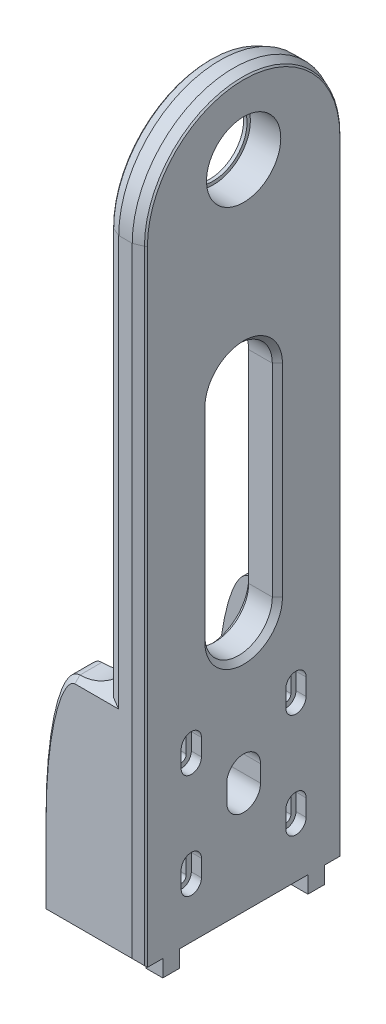
from build123d import *

# Parameters (mm, degrees)
SKETCH1_W           = 30
SKETCH1_H           = 5
BOSS_EXTRUDE1_DEPTH = 30
SKETCH2_W           = 10
SKETCH2_H           = 60
BOSS_EXTRUDE2_DEPTH = 210
SKETCH4_R           = 10
CUT_EXTRUDE1_DEPTH  = 10
CUT_EXTRUDE2_DEPTH  = 3
SKETCH6_R           = 11
CUT_EXTRUDE3_DEPTH  = 9
SKETCH7_R           = 1.5
SKETCH7_R_2         = 1.325
CUT_EXTRUDE4_DEPTH  = 15
SKETCH8_W           = 4.95
SKETCH8_H           = 4.9
BOSS_EXTRUDE3_DEPTH = 5
SKETCH10_W          = 8
SKETCH10_H          = 60
BOSS_EXTRUDE4_DEPTH = 20
FILLET1_RADIUS      = 30
FILLET1_LENGTH      = 10
FILLET3_SIZE        = 10
FILLET3_SIZE_2      = 40
FILLET4_SIZE        = 10
FILLET4_SIZE_2      = 40
CHAMFER1_SIZE       = 1.5
CHAMFER2_SIZE       = 1.5
CHAMFER3_SIZE       = 1.5
FILLET7_START       = 22
FILLET7_DEPTH       = 3.23595
FILLET7_START_2     = 25.23595
FILLET7_2_DEPTH     = 3.2640501
FILLET7_START_3     = -6
FILLET7_3_DEPTH     = 11
FILLET8_START       = -25.26405
FILLET8_DEPTH       = 3.26405
FILLET8_START_2     = -28.5000001
FILLET8_2_DEPTH     = 3.2359501
FILLET8_START_3     = -6
FILLET8_3_DEPTH     = 11


with BuildPart() as part:
    # Sketch1 → Boss-Extrude1 (new, symmetric)
    with BuildSketch(Plane.XY):
        with Locations((0, -2.5)):
            Rectangle(SKETCH1_W, SKETCH1_H)
    extrude(amount=BOSS_EXTRUDE1_DEPTH, both=True)

    # Sketch2 → Boss-Extrude2 (add)
    with BuildSketch(Plane(origin=(0, 0, 0), x_dir=(1, 0, 0), z_dir=(0, 1, 0))):
        with Locations((10, 0)):
            Rectangle(SKETCH2_W, SKETCH2_H)
    extrude(amount=BOSS_EXTRUDE2_DEPTH)

    # Sketch4 → Cut-Extrude1 (cut)
    with BuildSketch(Plane.ZY.offset(-5)):
        with Locations((0, 188)):
            Circle(SKETCH4_R)
        with BuildLine():
            Line((-17, 41), (-17, 46))
            ThreePointArc((-17, 46), (-15.5, 47.5), (-14, 46))
            Line((-14, 46), (-14, 41))
            ThreePointArc((-14, 41), (-15.5, 39.5), (-17, 41))
        make_face()
        with BuildLine():
            Line((14, 41), (14, 46))
            ThreePointArc((14, 46), (15.5, 47.5), (17, 46))
            Line((17, 46), (17, 41))
            ThreePointArc((17, 41), (15.5, 39.5), (14, 41))
        make_face()
        with BuildLine():
            Line((14, 10), (14, 15))
            ThreePointArc((14, 15), (15.5, 16.5), (17, 15))
            Line((17, 15), (17, 10))
            ThreePointArc((17, 10), (15.5, 8.5), (14, 10))
        make_face()
        with BuildLine():
            Line((-17, 10), (-17, 15))
            ThreePointArc((-17, 15), (-15.5, 16.5), (-14, 15))
            Line((-14, 15), (-14, 10))
            ThreePointArc((-14, 10), (-15.5, 8.5), (-17, 10))
        make_face()
        with BuildLine():
            Line((-5, 25.5), (-5, 30.5))
            ThreePointArc((-5, 30.5), (0, 35.5), (5, 30.5))
            Line((5, 30.5), (5, 25.5))
            ThreePointArc((5, 25.5), (0, 20.5), (-5, 25.5))
        make_face()
        with BuildLine():
            Line((-10, 70), (-10, 130))
            ThreePointArc((-10, 130), (0, 140), (10, 130))
            Line((10, 130), (10, 70))
            ThreePointArc((10, 70), (0, 60), (-10, 70))
        make_face()
    extrude(amount=-CUT_EXTRUDE1_DEPTH, mode=Mode.SUBTRACT)

    # Sketch5 → Cut-Extrude2 (cut)
    with BuildSketch(Plane(origin=(15, 0, 0), x_dir=(0, 0, -1), z_dir=(1, 0, 0))):
        with BuildLine():
            Line((-18.5, 41), (-18.5, 46))
            ThreePointArc((-18.5, 46), (-15.5, 49), (-12.5, 46))
            Line((-12.5, 46), (-12.5, 41))
            ThreePointArc((-12.5, 41), (-15.5, 38), (-18.5, 41))
        make_face()
        with BuildLine():
            Line((12.5, 41), (12.5, 46))
            ThreePointArc((12.5, 46), (15.5, 49), (18.5, 46))
            Line((18.5, 46), (18.5, 41))
            ThreePointArc((18.5, 41), (15.5, 38), (12.5, 41))
        make_face()
        with BuildLine():
            Line((12.5, 10), (12.5, 15))
            ThreePointArc((12.5, 15), (15.5, 18), (18.5, 15))
            Line((18.5, 15), (18.5, 10))
            ThreePointArc((18.5, 10), (15.5, 7), (12.5, 10))
        make_face()
        with BuildLine():
            Line((-18.5, 10), (-18.5, 15))
            ThreePointArc((-18.5, 15), (-15.5, 18), (-12.5, 15))
            Line((-12.5, 15), (-12.5, 10))
            ThreePointArc((-12.5, 10), (-15.5, 7), (-18.5, 10))
        make_face()
    extrude(amount=-CUT_EXTRUDE2_DEPTH, mode=Mode.SUBTRACT)

    # Sketch6 → Cut-Extrude3 (cut)
    with BuildSketch(Plane(origin=(15, 0, 0), x_dir=(0, 0, -1), z_dir=(1, 0, 0))):
        with Locations((0, 188)):
            Circle(SKETCH6_R)
    extrude(amount=-CUT_EXTRUDE3_DEPTH, mode=Mode.SUBTRACT)

    # Sketch7 → Cut-Extrude4 (cut)
    with BuildSketch(Plane.XZ.offset(5)):
        with Locations(Location((0, -15, 0), (0, 0, 270))):
            Circle(SKETCH7_R)
        with Locations(Location((0, 15, 0), (0, 0, 270))):
            Circle(SKETCH7_R)
        with Locations(Location((10, 0, 0), (0, 0, 90))):
            Circle(SKETCH7_R_2)
    extrude(amount=-CUT_EXTRUDE4_DEPTH, mode=Mode.SUBTRACT)

    # Sketch8 → Boss-Extrude3 (add)
    with BuildSketch(Plane.XZ.offset(5)):
        with Locations((12.525, 21.5)):
            Rectangle(SKETCH8_W, SKETCH8_H)
        with Locations((12.525, -21.5)):
            Rectangle(SKETCH8_W, SKETCH8_H)
    extrude(amount=BOSS_EXTRUDE3_DEPTH)

    # Sketch10 → Boss-Extrude4 (add)
    with BuildSketch(Plane.ZY.offset(-5)):
        with Locations((26, 30)):
            Rectangle(SKETCH10_W, SKETCH10_H)
        with Locations((-26, 30)):
            Rectangle(SKETCH10_W, SKETCH10_H)
    extrude(amount=BOSS_EXTRUDE4_DEPTH)

    # Fillet1: full round fillet: the end face becomes a half cylinder, R = half its width
    fillet1_face = Plane((10, 210, 0), x_dir=(-1, 0, 0), z_dir=(0, 1, 0))  # on the end face: x along it, z out of the body
    fillet1_slab = fillet1_face.offset(-FILLET1_RADIUS / 2) * Box(FILLET1_LENGTH, 2 * FILLET1_RADIUS, FILLET1_RADIUS, mode=Mode.PRIVATE)  # the body's end, R deep
    fillet1_round = Plane((10, 180, 0), x_dir=(0, 1, 0), z_dir=(-1, 0, 0)) * Cylinder(FILLET1_RADIUS, FILLET1_LENGTH, mode=Mode.PRIVATE)  # its axis R under the face
    add(fillet1_slab - fillet1_round, mode=Mode.SUBTRACT)

    # Fillet3
    # a fillet whose section is not a circle: 40, 10 mm, written as the material it takes off along each edge
    with BuildSketch(Plane(origin=(-15, 60, 78), x_dir=(1, 0, 0), z_dir=(0, 0, -1))) as fillet3_piece_1_section:
        with BuildLine():
            Bezier((FILLET3_SIZE, 0), (0, 0), (0, FILLET3_SIZE_2), weights=[1, 0.707106781, 1])
            Line((0, FILLET3_SIZE_2), (0, 0))
            Line((0, 0), (FILLET3_SIZE, 0))
        make_face()
    fillet3_piece_1 = extrude(amount=208, mode=Mode.PRIVATE)
    fillet3_piece_1 = split(fillet3_piece_1, bisect_by=Plane(origin=(-15, 60, 22), z_dir=(0, 0, -1)), keep=Keep.TOP, mode=Mode.PRIVATE)
    add(fillet3_piece_1, mode=Mode.SUBTRACT)

    # Fillet4
    # a fillet whose section is not a circle: 40, 10 mm, written as the material it takes off along each edge
    with BuildSketch(Plane(origin=(-15, 60, -78), x_dir=(1, 0, 0), z_dir=(0, 0, 1))) as fillet4_piece_1:
        with BuildLine():
            Bezier((FILLET4_SIZE, 0), (0, 0), (0, -FILLET4_SIZE_2), weights=[1, 0.707106781, 1])
            Line((0, -FILLET4_SIZE_2), (0, 0))
            Line((0, 0), (FILLET4_SIZE, 0))
        make_face()
    extrude(amount=208, mode=Mode.SUBTRACT)

    # Chamfer1
    chamfer1_edges = [part.edges().sort_by_distance(p)[0] for p in [
        (5, 120, -30),
        (15, 87.5, -30),
        (5, 210, 0),
        (15, 210, 0),
        (5, 120, 30),
        (15, 87.5, 30),
        (0, -5, 30),
        (-15, 7.5, 30),
        (-13.453414336, 41.369056546, 30),
        (0, 60, 30),
    ]]
    chamfer(chamfer1_edges, length=CHAMFER1_SIZE)

    # Chamfer2
    chamfer2_edges = [part.edges().sort_by_distance(p)[0] for p in [
        (13.5, 88.25, 30),
        (13.5, 210, 0),
        (13.5, 87.5, -30),
        (6.5, 119.25, 30),
        (6.5, 210, 0),
        (6.5, 120, -30),
        (-0.75, -5, -30),
        (-15, 7.5, -30),
        (-13.452762376, 41.373182547, -30),
        (0.75, 60, -30),
    ]]
    chamfer(chamfer2_edges, length=CHAMFER2_SIZE - 0.0001)  # a hair under: the kernel refuses the full size

    # Chamfer3
    chamfer3_edges = [part.edges().sort_by_distance(p)[0] for p in [
        (15, 60, 0),
        (15, 100, -10),
        (15, 140, 0),
        (15, 100, 10),
        (5, 60, 0),
        (5, 100, 10),
        (5, 140, 0),
        (5, 100, -10),
    ]]
    chamfer(chamfer3_edges, length=CHAMFER3_SIZE)

    # Fillet7: read off the stored shape, not the designer's step
    # Fillet7 outline → Fillet7 (add)
    with BuildSketch(Plane.XY.offset(FILLET7_START)):
        with BuildLine():
            Line((5, 60), (5, 65))
            add(Edge.make_bspline(
                [(5, 65), (5, 60), (-5, 60)],
                knots=[0, 0, 0, 1, 1, 1], degree=2, weights=[1, 0.707106781, 1]))
            Line((-5, 60), (5, 60))
        make_face()
    extrude(amount=FILLET7_DEPTH)

    # Fillet7 2 outline → Fillet7 2 (add)
    with BuildSketch(Plane.XY.offset(FILLET7_START_2)):
        with BuildLine():
            Line((5, 60), (5, 65))
            add(Edge.make_bspline(
                [(5, 65), (5, 60), (-5, 60)],
                knots=[0, 0, 0, 1, 1, 1], degree=2, weights=[1, 0.707106781, 1]))
            Line((-5, 60), (5, 60))
        make_face()
    extrude(amount=FILLET7_2_DEPTH)

    # Fillet7 3 outline → Fillet7 3 (cut)
    with BuildSketch(Plane.YZ.offset(FILLET7_START_3)):
        Polygon((60, 28.5000001), (65.5, 23), (67, 23), (67, 28.5000001), align=None)
    extrude(amount=FILLET7_3_DEPTH, mode=Mode.SUBTRACT)

    # Fillet8: read off the stored shape, not the designer's step
    # Fillet8 outline → Fillet8 (add)
    with BuildSketch(Plane.XY.offset(FILLET8_START)):
        with BuildLine():
            Line((5, 60), (5, 65))
            add(Edge.make_bspline(
                [(5, 65), (5, 60), (-5, 60)],
                knots=[0, 0, 0, 1, 1, 1], degree=2, weights=[1, 0.707106781, 1]))
            Line((-5, 60), (5, 60))
        make_face()
    extrude(amount=FILLET8_DEPTH)

    # Fillet8 2 outline → Fillet8 2 (add)
    with BuildSketch(Plane.XY.offset(FILLET8_START_2)):
        with BuildLine():
            Line((5, 60), (5, 65))
            add(Edge.make_bspline(
                [(5, 65), (5, 60), (-5, 60)],
                knots=[0, 0, 0, 1, 1, 1], degree=2, weights=[1, 0.707106781, 1]))
            Line((-5, 60), (5, 60))
        make_face()
    extrude(amount=FILLET8_2_DEPTH)

    # Fillet8 3 outline → Fillet8 3 (cut)
    with BuildSketch(Plane.YZ.offset(FILLET8_START_3)):
        Polygon((65.5, -23), (60, -28.5000001), (67, -28.5000001), (67, -23), align=None)
    extrude(amount=FILLET8_3_DEPTH, mode=Mode.SUBTRACT)


solid = part.part
